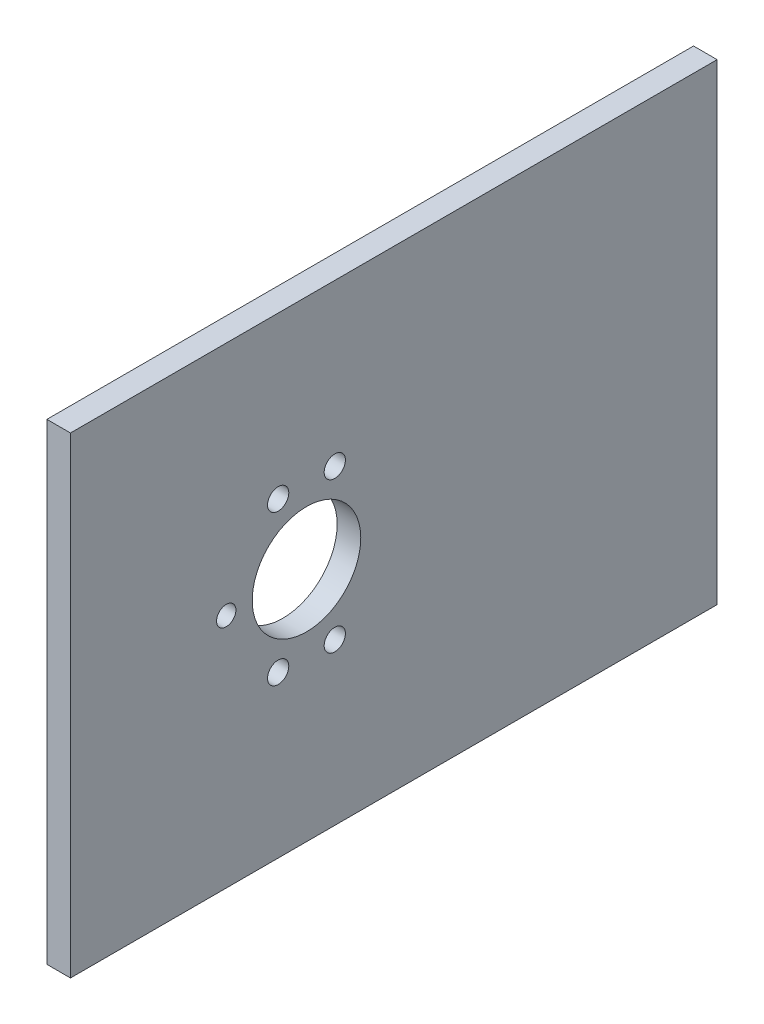
from build123d import *

# Parameters (mm, degrees)
SKIZZE1_R                       = 11.5
SKIZZE1_R_2                     = 2.25
SKIZZE1_R_3                     = 2.05
AUFSATZ_LINEAR_AUSTRAGEN1_DEPTH = 5


with BuildPart() as part:
    # Skizze1 → Aufsatz-Linear austragen1 (new body)
    with BuildSketch(Plane(origin=(0, 0, 0), x_dir=(0, 0, -1), z_dir=(1, 0, 0))):
        Polygon((-92, 59.908196572), (-192, 59.908196572), (-192, -40.091803428), (-92, -40.091803428), (-55, -40.091803428), (-55, 59.908196572), align=None)
        with Locations((-142, 9.908196572)):
            Circle(SKIZZE1_R, mode=Mode.SUBTRACT)
        with Locations((-148, 25.814170293)):
            Circle(SKIZZE1_R_2, mode=Mode.SUBTRACT)
        with Locations((-136, 25.814170293)):
            Circle(SKIZZE1_R_2, mode=Mode.SUBTRACT)
        with Locations((-159, 9.908196572)):
            Circle(SKIZZE1_R_3, mode=Mode.SUBTRACT)
        with Locations((-148, -5.997777148)):
            Circle(SKIZZE1_R_2, mode=Mode.SUBTRACT)
        with Locations((-136, -5.997777148)):
            Circle(SKIZZE1_R_2, mode=Mode.SUBTRACT)
    extrude(amount=AUFSATZ_LINEAR_AUSTRAGEN1_DEPTH)


solid = part.part
